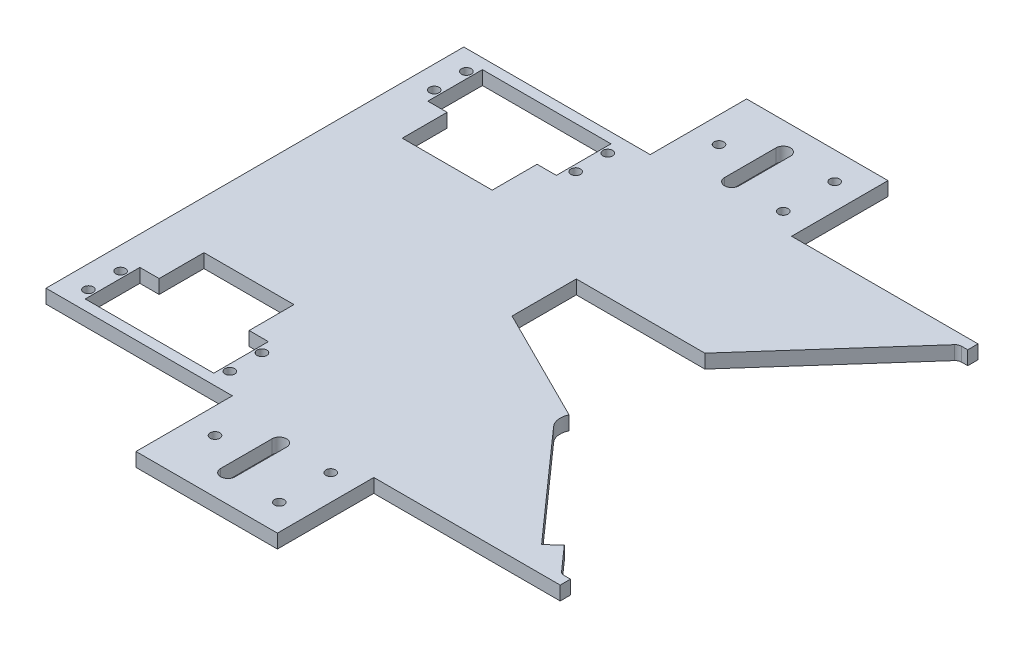
from build123d import *

# Parameters (mm, degrees)
BOSS_EXTRUDE1_DEPTH = 4.3
CUT_EXTRUDE1_DEPTH  = 4.5
FILLET1_R           = 2
CUT_EXTRUDE2_DEPTH  = 10
SKETCH8_R           = 1.5
CUT_EXTRUDE3_DEPTH  = 10
SKETCH9_R           = 1.5
CUT_EXTRUDE4_DEPTH  = 10
CUT_EXTRUDE5_DEPTH  = 10


with BuildPart() as part:
    # Sketch2 → Boss-Extrude1 (new body)
    with BuildSketch(Plane(origin=(0, 0, 0), x_dir=(1, 0, 0), z_dir=(0, 1, 0))):
        Polygon((0, 0), (0, 65), (58, 65), (58, 95), (102, 95), (102, 65), (160, 65), (160, 0), align=None)
    extrude(amount=BOSS_EXTRUDE1_DEPTH)

    # Mirror1: part across plane


with BuildPart() as part_1:
    add(part.part)
    add(part.part.mirror(Plane(origin=(0, 4.3, 0), x_dir=(1, 0, 0), z_dir=(0, 0, -1))))

    # Sketch3 → Cut-Extrude1 (cut)
    with BuildSketch(Plane(origin=(0, 4.3, 0), x_dir=(1, 0, 0), z_dir=(0, 1, 0))):
        Polygon((160, -61.8), (160, 61.8), (157.156451185, 61.8), (120.012594795, 20), (80.012594795, 20), (80.012594795, 0), (120, -20), (157.155555556, -61.8), align=None)
    extrude(amount=-CUT_EXTRUDE1_DEPTH, mode=Mode.SUBTRACT)

    # Fillet1
    fillet1_edges = [part_1.edges().sort_by_distance(p)[0] for p in [
        (157.156451185, 2.15, -61.8),
        (157.155555556, 2.15, 61.8),
    ]]
    fillet(fillet1_edges, radius=FILLET1_R)

    # Sketch6 → Cut-Extrude2 (cut)
    with BuildSketch(Plane(origin=(0, 4.3, 0), x_dir=(1, 0, 0), z_dir=(0, 1, 0))):
        Polygon((9, -61.8), (49, -61.8), (49, -44.8), (43, -44.8), (43, -30.841820122), (15, -30.841820122), (15, -44.8), (9, -44.8), align=None)
        Polygon((9, 44.8), (15, 44.8), (15, 30.841820122), (43, 30.841820122), (43, 44.8), (49, 44.8), (49, 61.8), (9, 61.8), align=None)
    extrude(amount=-CUT_EXTRUDE2_DEPTH, mode=Mode.SUBTRACT)

    # Sketch8 → Cut-Extrude3 (cut)
    with BuildSketch(Plane(origin=(0, 4.3, 0), x_dir=(1, 0, 0), z_dir=(0, 1, 0))):
        with Locations((7, 58.8)):
            Circle(SKETCH8_R)
        with Locations((7, 48.8)):
            Circle(SKETCH8_R)
        with Locations((51, 48.8)):
            Circle(SKETCH8_R)
        with Locations((51, 58.8)):
            Circle(SKETCH8_R)
        with Locations((7, -48.8)):
            Circle(SKETCH8_R)
        with Locations((7, -58.8)):
            Circle(SKETCH8_R)
        with Locations((51, -58.8)):
            Circle(SKETCH8_R)
        with Locations((51, -48.8)):
            Circle(SKETCH8_R)
    extrude(amount=-CUT_EXTRUDE3_DEPTH, mode=Mode.SUBTRACT)

    # Sketch9 → Cut-Extrude4 (cut)
    with BuildSketch(Plane.XZ):
        with Locations((94, 70.4)):
            Circle(SKETCH9_R)
        with Locations((66, 78.4)):
            Circle(SKETCH9_R)
        with Locations((66, -78.4)):
            Circle(SKETCH9_R)
        with Locations((94, -86.4)):
            Circle(SKETCH9_R)
        with Locations((94, 86.4)):
            Circle(SKETCH9_R)
        with Locations((94, -70.4)):
            Circle(SKETCH9_R)
        with BuildLine():
            Line((75.75, 70.4), (75.75, 86.4))
            ThreePointArc((75.75, 86.4), (78, 88.65), (80.25, 86.4))
            Line((80.25, 86.4), (80.25, 70.4))
            ThreePointArc((80.25, 70.4), (78, 68.15), (75.75, 70.4))
        make_face()
        with BuildLine():
            Line((75.75, -86.4), (75.75, -70.4))
            ThreePointArc((75.75, -70.4), (78, -68.15), (80.25, -70.4))
            Line((80.25, -70.4), (80.25, -86.4))
            ThreePointArc((80.25, -86.4), (78, -88.65), (75.75, -86.4))
        make_face()
    extrude(amount=-CUT_EXTRUDE4_DEPTH, mode=Mode.SUBTRACT)

    # Sketch10 → Cut-Extrude5 (cut)
    with BuildSketch(Plane(origin=(0, 4.3, 0), x_dir=(1, 0, 0), z_dir=(0, 1, 0))):
        with BuildLine():
            Line((123.321819194, -23.737046593), (149.896372747, -53.633419341))
            Line((149.896372747, -53.633419341), (146.159326154, -56.955238535))
            Line((146.159326154, -56.955238535), (116.262953407, -23.321819194))
            ThreePointArc((116.262953407, -23.321819194), (120.29361011, -15.008628134), (123.321819194, -23.737046593))
        make_face()
    extrude(amount=-CUT_EXTRUDE5_DEPTH, mode=Mode.SUBTRACT)


solid = part_1.part
